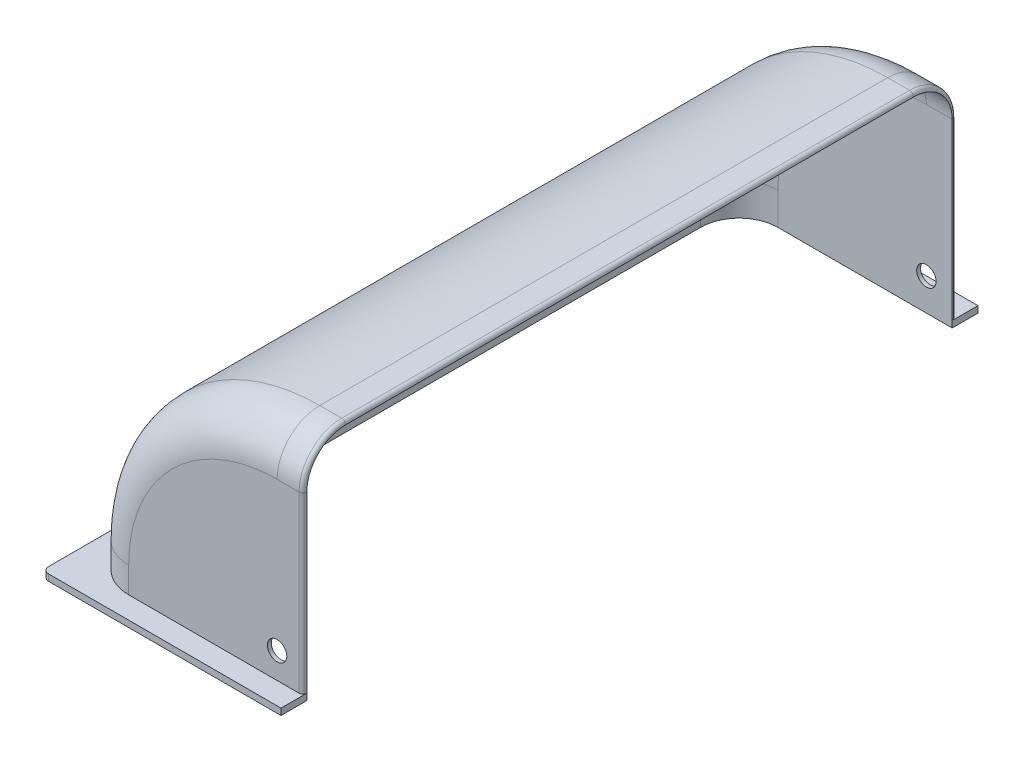
from build123d import *

# Parameters (mm, degrees)
BOSS_EXTRUDE1_DEPTH = 5
BOSS_EXTRUDE3_DEPTH = 20
FILLET5_R           = 30
FILLET6_R           = 33
FILLET4_R           = 5
REVOLVE3_ANGLE      = 90
BOSS_EXTRUDE4_DEPTH = 20
CUT_EXTRUDE1_REACH  = 577.05
SKETCH10_R          = 7.5
FILLET7_R           = 3


with BuildPart() as part:
    # Sketch1 → Boss-Extrude1 (new body)
    with BuildSketch(Plane(origin=(0, 0, 0), x_dir=(1, 0, 0), z_dir=(0, 1, 0))):
        Polygon((-165, 270), (-165, -270), (0, -270), (0, -250), (-145, -250), (-145, 250), (0, 250), (0, 270), align=None)
    extrude(amount=BOSS_EXTRUDE1_DEPTH)

    # Sketch7 → Boss-Extrude3 (add)
    with BuildSketch(Plane(origin=(0, 5, 0), x_dir=(1, 0, 0), z_dir=(0, 1, 0))):
        Polygon((0, 253), (-148, 253), (-148, -253), (0, -253), (0, -250), (-145, -250), (-145, 250), (0, 250), align=None)
    extrude(amount=BOSS_EXTRUDE3_DEPTH)

    # Fillet5
    fillet5_edges = [part.edges().sort_by_distance(p)[0] for p in [
        (-145, 12.5, -250),
        (-145, 12.5, 250),
    ]]
    fillet(fillet5_edges, radius=FILLET5_R)

    # Fillet6
    fillet6_edges = [part.edges().sort_by_distance(p)[0] for p in [
        (-148, 15, -253),
        (-148, 15, 253),
    ]]
    fillet(fillet6_edges, radius=FILLET6_R)

    # Fillet4
    fillet4_edges = [part.edges().sort_by_distance(p)[0] for p in [
        (-165, 2.5, 270),
        (-165, 2.5, -270),
    ]]
    fillet(fillet4_edges, radius=FILLET4_R)

    # Sketch8 → Revolve3 (revolve)
    with BuildSketch(Plane(origin=(0, 25, 0), x_dir=(1, 0, 0), z_dir=(0, 1, 0))):
        with BuildLine():
            Line((0, 253), (-115, 253))
            ThreePointArc((-115, 253), (-138.334523779, 243.334523779), (-148, 220))
            Line((-148, 220), (-148, -220))
            ThreePointArc((-148, -220), (-138.334523779, -243.334523779), (-115, -253))
            Line((-115, -253), (0, -253))
            Line((0, -253), (0, -250))
            Line((0, -250), (-115, -250))
            ThreePointArc((-115, -250), (-136.213203436, -241.213203436), (-145, -220))
            Line((-145, -220), (-145, 220))
            ThreePointArc((-145, 220), (-136.213203436, 241.213203436), (-115, 250))
            Line((-115, 250), (0, 250))
            Line((0, 250), (0, 253))
        make_face()
    revolve(axis=Axis((0, 25, -250), (0, 0, -1)), revolution_arc=REVOLVE3_ANGLE)

    # Sketch9 → Boss-Extrude4 (add)
    with BuildSketch(Plane(origin=(0, 0, 0), x_dir=(0, 0, -1), z_dir=(1, 0, 0))):
        with BuildLine():
            Line((253, 25), (253, 140))
            ThreePointArc((253, 140), (243.334523779, 163.334523779), (220, 173))
            Line((220, 173), (-220, 173))
            ThreePointArc((-220, 173), (-243.334523779, 163.334523779), (-253, 140))
            Line((-253, 140), (-253, 25))
            Line((-253, 25), (-253, 5))
            Line((-253, 5), (-270, 5))
            Line((-270, 5), (-270, 0))
            Line((-270, 0), (-250, 0))
            Line((-250, 0), (-250, 25))
            Line((-250, 25), (-250, 140))
            ThreePointArc((-250, 140), (-241.213203436, 161.213203436), (-220, 170))
            Line((-220, 170), (220, 170))
            ThreePointArc((220, 170), (241.213203436, 161.213203436), (250, 140))
            Line((250, 140), (250, 25))
            Line((250, 25), (250, 0))
            Line((250, 0), (270, 0))
            Line((270, 0), (270, 5))
            Line((270, 5), (253, 5))
            Line((253, 5), (253, 25))
        make_face()
    extrude(amount=BOSS_EXTRUDE4_DEPTH)

    # Cut-Extrude1: up to this face of the body (flat: up to its plane)
    cut_extrude1_end = Plane(part.part.faces().sort_by_distance((-39.787657223, 64.787657223, -253))[0])
    # Sketch10 → Cut-Extrude1 (cut, up to the picked face)
    with BuildSketch(Plane.XY.offset(253), mode=Mode.PRIVATE) as cut_extrude1_sk1:
        with Locations((0, 25)):
            Circle(SKETCH10_R)
    cut_extrude1_tool1 = split(extrude(cut_extrude1_sk1.sketch, amount=-CUT_EXTRUDE1_REACH, mode=Mode.PRIVATE), bisect_by=cut_extrude1_end, keep=Keep.BOTH, mode=Mode.PRIVATE)
    add(cut_extrude1_tool1.solids().sort_by(Axis((0, 25, 253), (0, 0, -1)))[0], mode=Mode.SUBTRACT)

    # Fillet7
    fillet7_edges = [part.edges().sort_by_distance(p)[0] for p in [
        (20, 72.5, -253),
        (20, 163.334523779, -243.334523779),
        (20, 173, 0),
        (20, 163.334523779, 243.334523779),
        (20, 72.5, 253),
    ]]
    fillet(fillet7_edges, radius=FILLET7_R - 0.0001)  # a hair under: the kernel refuses the full size


solid = part.part
